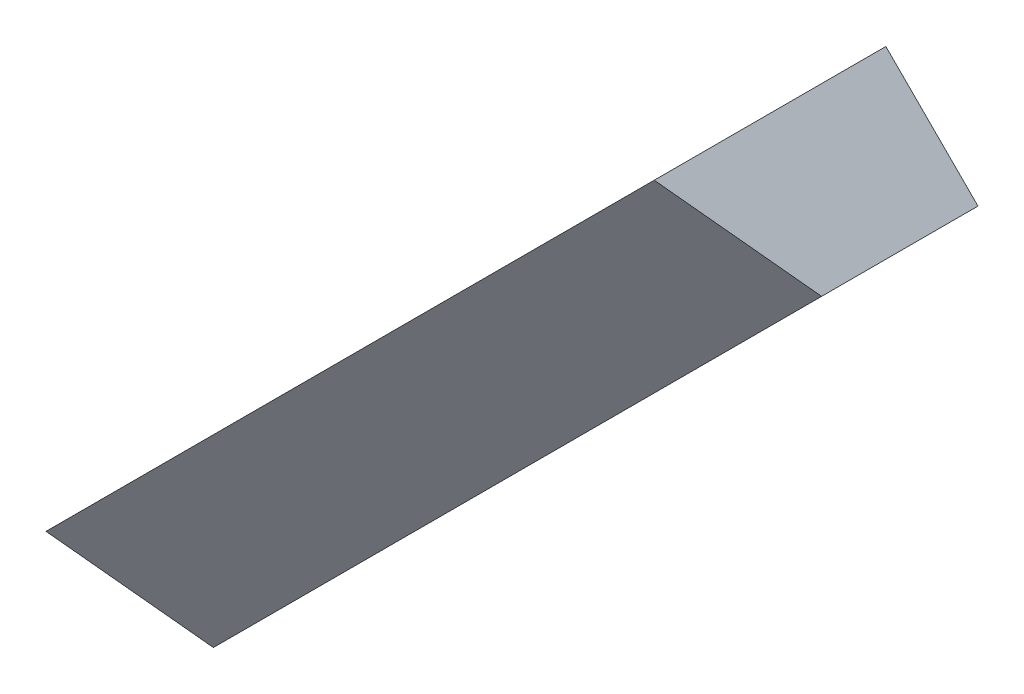
from build123d import *

# Parameters (mm, degrees)
CROQUIS1_R              = 1.6
SALIENTE_EXTRUIR1_DEPTH = 5
SALIENTE_EXTRUIR2_DEPTH = 33
CORTAR_EXTRUIR1_START   = -31.678641595
CORTAR_EXTRUIR1_DEPTH   = 6.273502652


# Read off the part's stored shape, not the designer's step: Cortar-Extruir1
with BuildPart() as part:
    # Croquis1 → Saliente-Extruir1 (new body)
    with BuildSketch(Plane.XY):
        Polygon((-19.258375223, 25.624876308), (-42.592899002, 2.290352529), (-39.057365096, -1.245181377), (-15.722841317, 22.089342402), align=None)
        with Locations((-38.703811705, 2.64390592)):
            Circle(CROQUIS1_R, mode=Mode.SUBTRACT)
        with Locations((-19.611928613, 21.735789012)):
            Circle(CROQUIS1_R, mode=Mode.SUBTRACT)
    extrude(amount=SALIENTE_EXTRUIR1_DEPTH)

    # Croquis2 → Saliente-Extruir2 (add)
    with BuildSketch(Plane(origin=(-20.151273236, -20.151273236, 0), x_dir=(0, 0, 1), z_dir=(-0.7071067811865464, -0.7071067811865488, 0))):
        Polygon((5, 26.737251519), (6, 26.737251519), (8.886751346, 31.737251519), (5, 31.737251519), align=None)
    extrude(amount=-SALIENTE_EXTRUIR2_DEPTH)

    # Cortar-Extruir1 outline → Cortar-Extruir1 (cut)
    with BuildSketch(Plane(origin=(0, 0, 0), x_dir=(0.7905694150420916, 0.4743416490252623, 0.38729833462074187), z_dir=(0.6123724356957988, -0.6123724356957947, -0.49999999999999467)).offset(CORTAR_EXTRUIR1_START)):
        with BuildLine():
            add(Edge.make_bspline(
                [(-27.74285361, 3.766078005), (-27.407443413, 4.436898399), (-28.245968905, 4.436898399), (-29.084494396, 4.436898399), (-28.581379101, 3.766078005), (-28.078263806, 3.095257612), (-27.74285361, 3.766078005)],
                knots=[0, 0, 0, 2.094395102, 2.094395102, 4.188790205, 4.188790205, 6.283185307, 6.283185307, 6.283185307], degree=2, weights=[1, 0.5, 1, 0.5, 1, 0.5, 1]))
        make_face()
        with BuildLine():
            add(Edge.make_bspline(
                [(-3.593319453, -8.308689073), (-3.257909256, -7.63786868), (-4.096434748, -7.63786868), (-4.934960239, -7.63786868), (-4.431844944, -8.308689073), (-3.928729649, -8.979509466), (-3.593319453, -8.308689073)],
                knots=[0, 0, 0, 2.094395102, 2.094395102, 4.188790205, 4.188790205, 6.283185307, 6.283185307, 6.283185307], degree=2, weights=[1, 0.5, 1, 0.5, 1, 0.5, 1]))
        make_face()
        with BuildLine():
            add(Edge.make_bspline(
                [(-0.91003788, -9.65032986), (-0.574627683, -8.979509466), (-1.413153175, -8.979509466), (-2.251678666, -8.979509466), (-1.748563371, -9.65032986), (-1.245448076, -10.321150253), (-0.91003788, -9.65032986)],
                knots=[0, 0, 0, 2.094395102, 2.094395102, 4.188790205, 4.188790205, 6.283185307, 6.283185307, 6.283185307], degree=2, weights=[1, 0.5, 1, 0.5, 1, 0.5, 1]))
        make_face()
        with BuildLine():
            add(Edge.make_bspline(
                [(-19.693008891, -0.258844354), (-19.357598694, 0.411976039), (-20.196124186, 0.411976039), (-21.034649677, 0.411976039), (-20.531534382, -0.258844354), (-20.028419087, -0.929664747), (-19.693008891, -0.258844354)],
                knots=[0, 0, 0, 2.094395102, 2.094395102, 4.188790205, 4.188790205, 6.283185307, 6.283185307, 6.283185307], degree=2, weights=[1, 0.5, 1, 0.5, 1, 0.5, 1]))
        make_face()
        with BuildLine():
            add(Edge.make_bspline(
                [(-17.009727318, -1.600485141), (-16.674317121, -0.929664747), (-17.512842613, -0.929664747), (-18.351368104, -0.929664747), (-17.848252809, -1.600485141), (-17.345137514, -2.271305534), (-17.009727318, -1.600485141)],
                knots=[0, 0, 0, 2.094395102, 2.094395102, 4.188790205, 4.188790205, 6.283185307, 6.283185307, 6.283185307], degree=2, weights=[1, 0.5, 1, 0.5, 1, 0.5, 1]))
        make_face()
        with BuildLine():
            add(Edge.make_bspline(
                [(-25.059572037, 2.424437219), (-24.72416184, 3.095257612), (-25.562687332, 3.095257612), (-26.401212823, 3.095257612), (-25.898097528, 2.424437219), (-25.394982233, 1.753616826), (-25.059572037, 2.424437219)],
                knots=[0, 0, 0, 2.094395102, 2.094395102, 4.188790205, 4.188790205, 6.283185307, 6.283185307, 6.283185307], degree=2, weights=[1, 0.5, 1, 0.5, 1, 0.5, 1]))
        make_face()
        with BuildLine():
            add(Edge.make_bspline(
                [(-22.376290464, 1.082796432), (-22.040880267, 1.753616826), (-22.879405759, 1.753616826), (-23.71793125, 1.753616826), (-23.214815955, 1.082796432), (-22.71170066, 0.411976039), (-22.376290464, 1.082796432)],
                knots=[0, 0, 0, 2.094395102, 2.094395102, 4.188790205, 4.188790205, 6.283185307, 6.283185307, 6.283185307], degree=2, weights=[1, 0.5, 1, 0.5, 1, 0.5, 1]))
        make_face()
        with BuildLine():
            add(Edge.make_bspline(
                [(-8.959882599, -5.6254075), (-8.624472402, -4.954587107), (-9.462997894, -4.954587107), (-10.301523385, -4.954587107), (-9.79840809, -5.6254075), (-9.295292795, -6.296227893), (-8.959882599, -5.6254075)],
                knots=[0, 0, 0, 2.094395102, 2.094395102, 4.188790205, 4.188790205, 6.283185307, 6.283185307, 6.283185307], degree=2, weights=[1, 0.5, 1, 0.5, 1, 0.5, 1]))
        make_face()
        with BuildLine():
            add(Edge.make_bspline(
                [(-6.276601026, -6.967048287), (-5.941190829, -6.296227893), (-6.779716321, -6.296227893), (-7.618241812, -6.296227893), (-7.115126517, -6.967048287), (-6.612011222, -7.63786868), (-6.276601026, -6.967048287)],
                knots=[0, 0, 0, 2.094395102, 2.094395102, 4.188790205, 4.188790205, 6.283185307, 6.283185307, 6.283185307], degree=2, weights=[1, 0.5, 1, 0.5, 1, 0.5, 1]))
        make_face()
        with BuildLine():
            add(Edge.make_bspline(
                [(-14.326445745, -2.942125927), (-13.991035548, -2.271305534), (-14.82956104, -2.271305534), (-15.668086531, -2.271305534), (-15.164971236, -2.942125927), (-14.661855941, -3.61294632), (-14.326445745, -2.942125927)],
                knots=[0, 0, 0, 2.094395102, 2.094395102, 4.188790205, 4.188790205, 6.283185307, 6.283185307, 6.283185307], degree=2, weights=[1, 0.5, 1, 0.5, 1, 0.5, 1]))
        make_face()
        with BuildLine():
            add(Edge.make_bspline(
                [(-11.643164172, -4.283766714), (-11.307753975, -3.61294632), (-12.146279467, -3.61294632), (-12.984804958, -3.61294632), (-12.481689663, -4.283766714), (-11.978574368, -4.954587107), (-11.643164172, -4.283766714)],
                knots=[0, 0, 0, 2.094395102, 2.094395102, 4.188790205, 4.188790205, 6.283185307, 6.283185307, 6.283185307], degree=2, weights=[1, 0.5, 1, 0.5, 1, 0.5, 1]))
        make_face()
    extrude(amount=CORTAR_EXTRUIR1_DEPTH, mode=Mode.SUBTRACT)


solid = part.part
